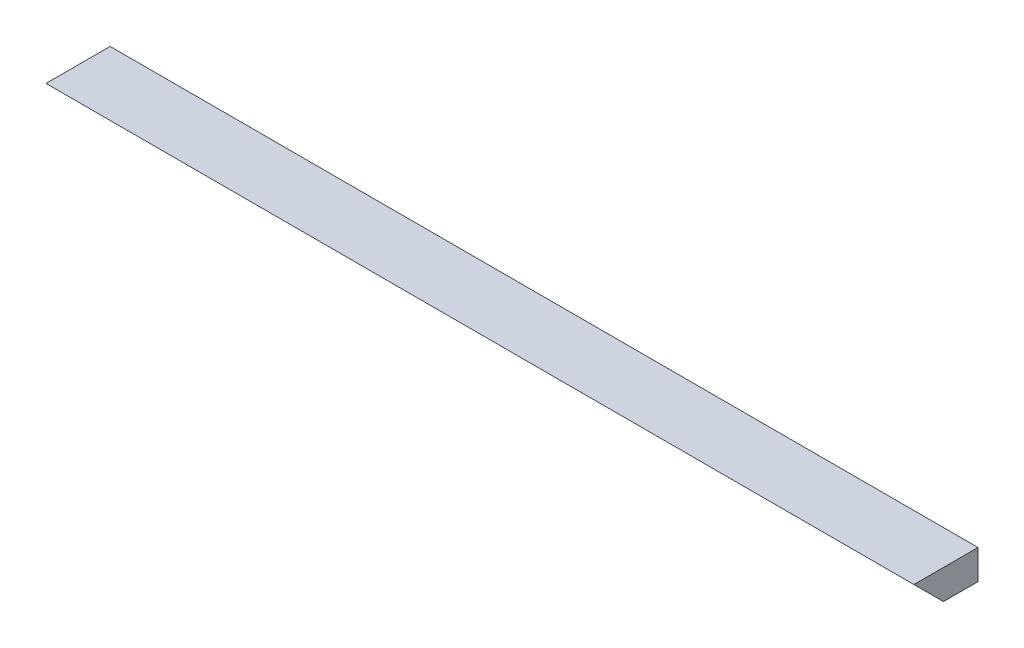
from build123d import *

# Parameters (mm, degrees)
SKETCH1_W               = 63.5
SKETCH1_H               = 19.05
BOSS_EXTRUDE1_DEPTH     = 279.4
CUT_EXTRUDE1_DEPTH      = 282.359464253
CUT_EXTRUDE1_DEPTH_BACK = 282.359464253


with BuildPart() as part:
    # Sketch1 → Boss-Extrude1 (new, symmetric)
    with BuildSketch(Plane(origin=(0, 0, 0), x_dir=(0, 0, -1), z_dir=(1, 0, 0))):
        Rectangle(SKETCH1_W, SKETCH1_H)
    extrude(amount=BOSS_EXTRUDE1_DEPTH, both=True)

    # Sketch2 → Cut-Extrude1 (cut, two sides: drawn at the far end of the back side and taken through both)
    with BuildSketch(Plane(origin=(0, 0, 0), x_dir=(0, 0, -1), z_dir=(1, 0, 0)).offset(-CUT_EXTRUDE1_DEPTH_BACK)):
        Polygon((-80.884917934, 80.884917934), (-9.525, 9.525), (9.525, -9.525), (80.884917934, -80.884917934), (-61.834917934, -223.604753801), (-223.604753801, -61.834917934), align=None)
    extrude(amount=CUT_EXTRUDE1_DEPTH + CUT_EXTRUDE1_DEPTH_BACK, mode=Mode.SUBTRACT)


solid = part.part
